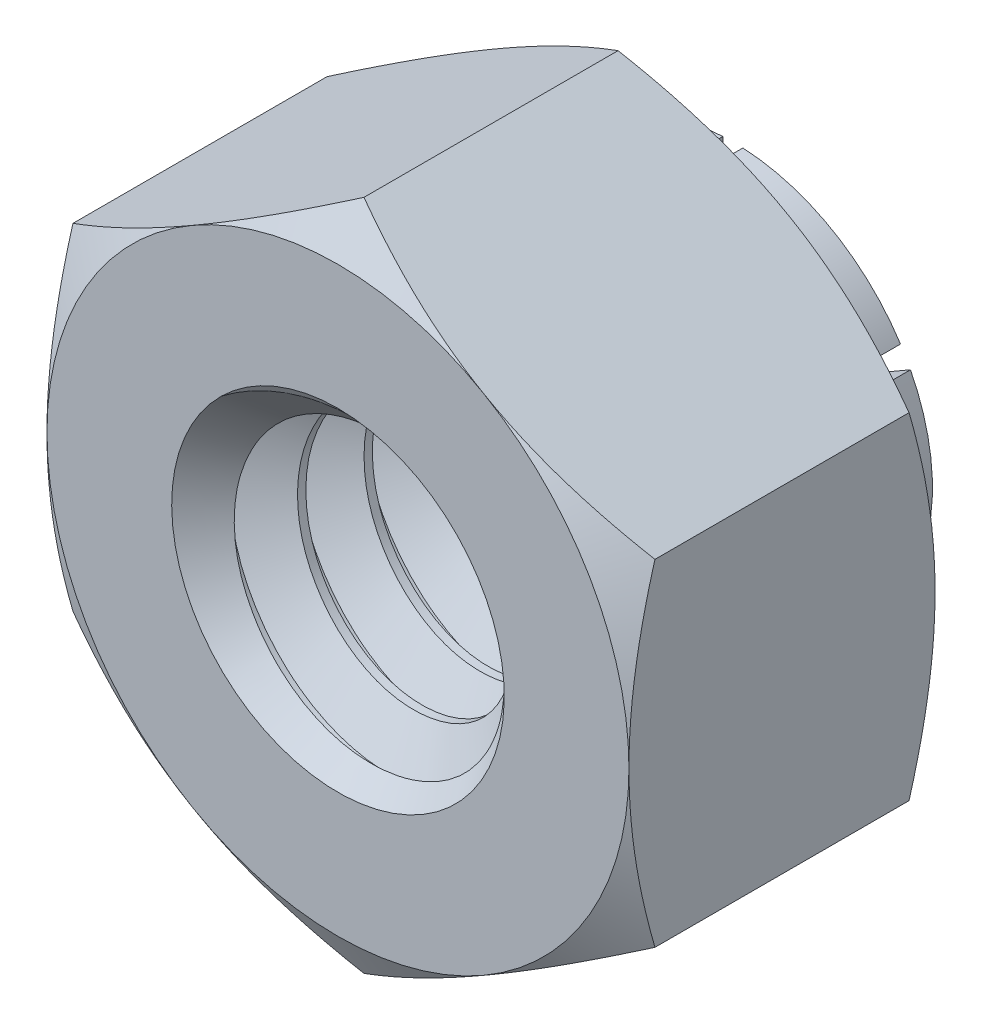
from build123d import *

# Parameters (mm, degrees)
EXTRUDE1_DEPTH          = 7.540625
SKETCH2_OUTSIDE_W       = 59.62
SKETCH2_OUTSIDE_H       = 61.34
SKETCH2_OUTSIDE_R       = 5.55625
CUT_EXTRUDE1_DEPTH      = 12.353215031
CUT_EXTRUDE1_DRAFT      = -60
SKETCH4_R               = 3.175
CUT_EXTRUDE3_DEPTH      = 12.353215031
SWEEP1_PITCH            = 1.27
CUT_EXTRUDE8_DEPTH      = 13.233749847
CUT_EXTRUDE9_DEPTH      = 12.353215203
SKETCH12_OUTSIDE_W      = 16.826
SKETCH12_OUTSIDE_H      = 18.546
SKETCH12_OUTSIDE_R      = 3.81
CUT_EXTRUDE10_DEPTH     = 1.696640625
SKETCH15_W              = 0.381
SKETCH15_H              = 6.415804866
CUT_EXTRUDE_THIN2_DEPTH = 1.188640625
CIRPATTERN1_COUNT       = 6
SKETCH3_OUTSIDE_W       = 55.988
SKETCH3_OUTSIDE_H       = 57.708
SKETCH3_OUTSIDE_R       = 5.55625
CUT_EXTRUDE2_DEPTH      = 11.304689311
CUT_EXTRUDE2_DRAFT      = -60


with BuildPart() as part:
    # Sketch1 → Extrude1 (new body)
    with BuildSketch(Plane.XY):
        Polygon((0, 6.415804866), (-5.55625, 3.207902433), (-5.55625, -3.207902433), (0, -6.415804866), (5.55625, -3.207902433), (5.55625, 3.207902433), align=None)
    extrude(amount=-EXTRUDE1_DEPTH)


with BuildPart() as cut_extrude1_tool:
    # Sketch2 outside → Cut-Extrude1 (with draft: the straight prism first)
    with BuildSketch(Plane.XY):
        Rectangle(SKETCH2_OUTSIDE_W, SKETCH2_OUTSIDE_H)
        Circle(SKETCH2_OUTSIDE_R, mode=Mode.SUBTRACT)
    extrude(amount=-CUT_EXTRUDE1_DEPTH)
    # Cut-Extrude1: the draft: its side faces are tilted about the plane it starts from
    cut_extrude1_sides = [cut_extrude1_tool.faces().sort_by_distance(p)[0] for p in [
        (0, -30.67, -6.176607515),
        (29.81, 0, -6.176607515),
        (0, 30.67, -6.176607515),
        (-29.81, 0, -6.176607515),
        (-5.55625, 0, -6.176607515),
    ]]
    draft(cut_extrude1_sides, Plane.XY, CUT_EXTRUDE1_DRAFT)


with BuildPart() as part_1:
    add(part.part)

    # Cut-Extrude1: cut by cut_extrude1_tool
    add(cut_extrude1_tool.part, mode=Mode.SUBTRACT)

    # Sketch4 → Cut-Extrude3 (cut, through all)
    with BuildSketch(Plane.XY):
        Circle(SKETCH4_R)
    extrude(amount=-CUT_EXTRUDE3_DEPTH, mode=Mode.SUBTRACT)

    # Sweep1: the profile of Sketch9 profile screwed along a right-hand helix of 6.9375 turns, 6 arcs to a turn; built about Z, then put on its axis
    sweep1_z = Axis((0, 0, 0), (0, 0, 1))
    sweep1_corners = [(2.350110803, 0, -0.635), (2.350110803, 0, -0.47625), (3.1753, 0, 0.000173205), (3.1753, 0, -1.111423205)]
    with BuildLine(mode=Mode.PRIVATE) as sweep1_profile:
        Line(sweep1_corners[0], sweep1_corners[1])
        Line(sweep1_corners[1], sweep1_corners[2])
        Line(sweep1_corners[2], sweep1_corners[3])
        Line(sweep1_corners[3], sweep1_corners[0])
    sweep1_cap = Face(sweep1_profile.wire())
    sweep1_turn_angles = [0, 30, 60, 90, 120, 150, 180, 210, 240, 270, 300, 330, 360]
    sweep1_turn_weights = [1, 0.8660254037844387, 1, 0.8660254037844387, 1, 0.8660254037844387, 1, 0.8660254037844387, 1, 0.8660254037844387, 1, 0.8660254037844387, 1]
    sweep1_turn_rails = [Edge.make_bspline([Vector(p[0], p[1], 0).rotate(sweep1_z, sweep1_turn_angles[k]) / sweep1_turn_weights[k] + Vector(0, 0, p[2] + SWEEP1_PITCH * sweep1_turn_angles[k] / 360) for k in range(13)], [0, 0, 0, 1, 1, 2, 2, 3, 3, 4, 4, 5, 5, 6, 6, 6], 2, sweep1_turn_weights) for p in sweep1_corners]
    sweep1_turn_sides = [Face.make_surface_from_curves(sweep1_turn_rails[p[0]], sweep1_turn_rails[p[1]]) for p in [(0, 1), (1, 2), (2, 3), (3, 0)]]
    sweep1_last_angles = [2160, 2190, 2220, 2250, 2280, 2310, 2340, 2370, 2400, 2430, 2460, 2478.75, 2497.5]
    sweep1_last_weights = [1, 0.8660254037844387, 1, 0.8660254037844387, 1, 0.8660254037844387, 1, 0.8660254037844387, 1, 0.8660254037844387, 1, 0.9469301294950992, 1]
    sweep1_last_rails = [Edge.make_bspline([Vector(p[0], p[1], 0).rotate(sweep1_z, sweep1_last_angles[k]) / sweep1_last_weights[k] + Vector(0, 0, p[2] + SWEEP1_PITCH * sweep1_last_angles[k] / 360) for k in range(13)], [0, 0, 0, 1, 1, 2, 2, 3, 3, 4, 4, 5, 5, 6, 6, 6], 2, sweep1_last_weights) for p in sweep1_corners]
    sweep1_last_sides = [Face.make_surface_from_curves(sweep1_last_rails[p[0]], sweep1_last_rails[p[1]]) for p in [(0, 1), (1, 2), (2, 3), (3, 0)]]
    sweep1 = Plane(origin=(0, 0, 0), x_dir=(0, 1, 0), z_dir=(0, 0, -1)) * Solid(Shell([*[p.moved(Location((0, 0, SWEEP1_PITCH * i))) for i in range(6) for p in sweep1_turn_sides], *sweep1_last_sides, sweep1_cap, sweep1_cap.rotate(sweep1_z, 2497.5).moved(Location((0, 0, SWEEP1_PITCH * 2497.5 / 360)))]))
    add(sweep1)

    # Sketch10 → Cut-Extrude8 (cut, through all)
    with BuildSketch(Plane.XY):
        Polygon((0, 6.415804866), (-5.55625, 3.207902433), (-5.55625, -3.207902433), (0, -6.415804866), (5.55625, -3.207902433), (5.55625, 3.207902433), align=None)
    extrude(amount=CUT_EXTRUDE8_DEPTH, mode=Mode.SUBTRACT)

    # Sketch11 → Cut-Extrude9 (cut, through all)
    with BuildSketch(Plane(origin=(0, 0, -7.540625), x_dir=(-1, 0, 0), z_dir=(0, 0, -1))):
        Polygon((5.55625, 3.207902433), (0, 6.415804866), (-5.55625, 3.207902433), (-5.55625, -3.207902433), (0, -6.415804866), (5.55625, -3.207902433), align=None)
    extrude(amount=CUT_EXTRUDE9_DEPTH, mode=Mode.SUBTRACT)

    # Sketch12 outside → Cut-Extrude10 (cut)
    with BuildSketch(Plane(origin=(0, 0, -7.540625), x_dir=(-1, 0, 0), z_dir=(0, 0, -1))):
        Rectangle(SKETCH12_OUTSIDE_W, SKETCH12_OUTSIDE_H)
        Circle(SKETCH12_OUTSIDE_R, mode=Mode.SUBTRACT)
    extrude(amount=-CUT_EXTRUDE10_DEPTH, mode=Mode.SUBTRACT)

    # Sketch15 → Cut-Extrude-Thin2 (cut)
    with BuildSketch(Plane(origin=(0, 0, -7.540625), x_dir=(-1, 0, 0), z_dir=(0, 0, -1))):
        with Locations((0, -3.207902433)):
            Rectangle(SKETCH15_W, SKETCH15_H)
    cut_extrude_thin2 = extrude(amount=-CUT_EXTRUDE_THIN2_DEPTH, mode=Mode.SUBTRACT)

    # CirPattern1: Cut-Extrude-Thin2 ×6 about axis
    cirpattern1_axis = Axis((0, 0, 0), (0, 0, 1))
    for i in range(1, CIRPATTERN1_COUNT):
        add(cut_extrude_thin2.rotate(cirpattern1_axis, i * 360 / CIRPATTERN1_COUNT), mode=Mode.SUBTRACT)


with BuildPart() as cut_extrude2_tool:
    # Sketch3 outside → Cut-Extrude2 (with draft: the straight prism first)
    with BuildSketch(Plane(origin=(0, 0, -5.843984375), x_dir=(-1, 0, 0), z_dir=(0, 0, -1))):
        Rectangle(SKETCH3_OUTSIDE_W, SKETCH3_OUTSIDE_H)
        Circle(SKETCH3_OUTSIDE_R, mode=Mode.SUBTRACT)
    extrude(amount=-CUT_EXTRUDE2_DEPTH)
    # Cut-Extrude2: the draft: its side faces are tilted about the plane it starts from
    cut_extrude2_sides = [cut_extrude2_tool.faces().sort_by_distance(p)[0] for p in [
        (0, -28.854, -0.191639719),
        (-27.994, 0, -0.191639719),
        (0, 28.854, -0.191639719),
        (27.994, 0, -0.191639719),
        (5.55625, 0, -0.191639719),
    ]]
    draft(cut_extrude2_sides, Plane(origin=(0, 0, -5.843984375), x_dir=(-1, 0, 0), z_dir=(0, 0, -1)), CUT_EXTRUDE2_DRAFT)


with BuildPart() as part_2:
    add(part_1.part)

    # Cut-Extrude2: cut by cut_extrude2_tool
    add(cut_extrude2_tool.part, mode=Mode.SUBTRACT)

    # Cut-Extrude6 cone 1 section (through the dimple's axis) → Cut-Extrude6 (revolve, cut)
    with BuildSketch(Plane(origin=(0, 0, 0), x_dir=(0, -1, 0), z_dir=(1, 0, 0))):
        Polygon((0, 0), (3.175, 0), (0, 3.175), align=None)
    revolve(axis=Axis((0, 0, 0), (0, 0, -1)), mode=Mode.SUBTRACT)

    # Cut-Extrude7 cone 1 section (through the dimple's axis) → Cut-Extrude7 (revolve, cut)
    with BuildSketch(Plane(origin=(0, 0, -7.540625), x_dir=(0, 1, 0), z_dir=(1, 0, 0))):
        Polygon((0, 0), (3.175, 0), (0, 3.175), align=None)
    revolve(axis=Axis((0, 0, -7.540625), (0, 0, 1)), mode=Mode.SUBTRACT)


solid = part_2.part
